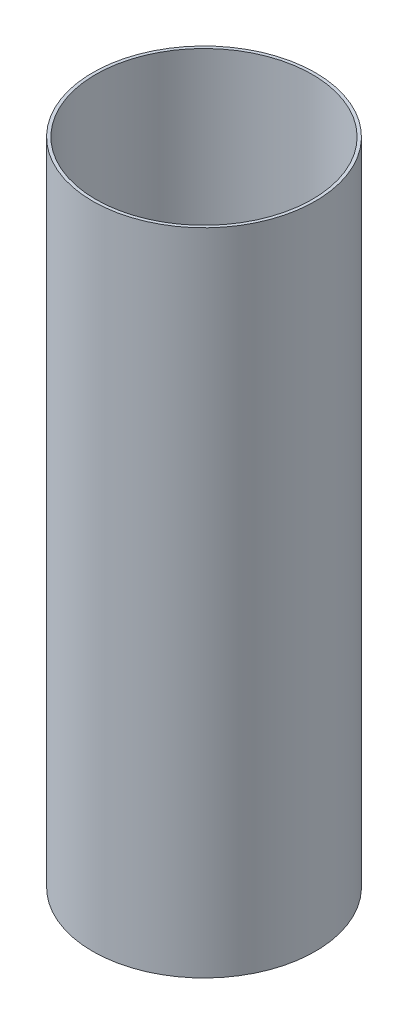
from build123d import *

# Parameters (mm, degrees)
SKETCH2_R           = 78.359
SKETCH2_R_2         = 76.2
BOSS_EXTRUDE1_DEPTH = 457.2


with BuildPart() as part:
    # Sketch2 → Boss-Extrude1 (new body)
    with BuildSketch(Plane(origin=(0, 0, 0), x_dir=(1, 0, 0), z_dir=(0, 1, 0))):
        Circle(SKETCH2_R)
        Circle(SKETCH2_R_2, mode=Mode.SUBTRACT)
    extrude(amount=BOSS_EXTRUDE1_DEPTH)


solid = part.part
